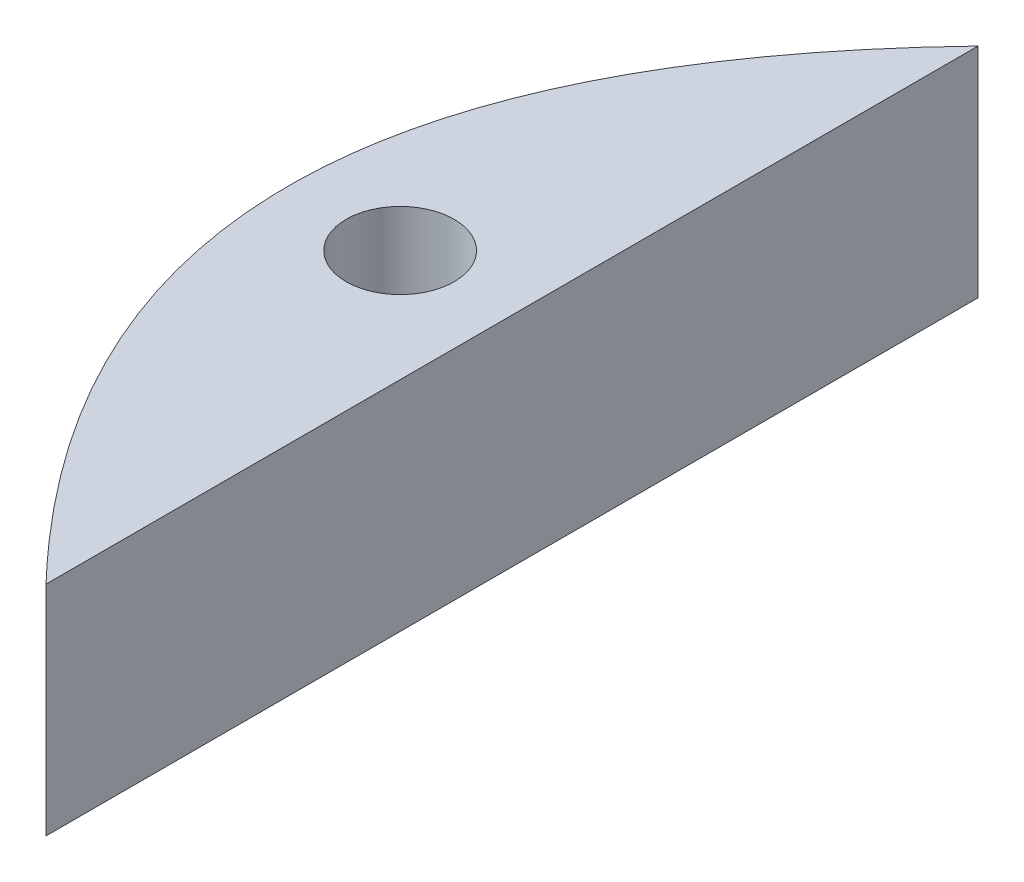
from build123d import *

# Parameters (mm, degrees)
SKETCH1_R           = 1.45
BOSS_EXTRUDE1_DEPTH = 5.85


with BuildPart() as part:
    # Sketch1 → Boss-Extrude1 (new body)
    with BuildSketch(Plane(origin=(0, 0, 0), x_dir=(1, 0, 0), z_dir=(0, 1, 0))):
        with BuildLine():
            Line((3, 12.5), (3, -12.5))
            add(Edge.make_bspline(
                [(3, 12.5), (-9, 0), (3, -12.5)],
                knots=[0, 0, 0, 1, 1, 1], degree=2))
        make_face()
        Circle(SKETCH1_R, mode=Mode.SUBTRACT)
    extrude(amount=BOSS_EXTRUDE1_DEPTH)


solid = part.part
